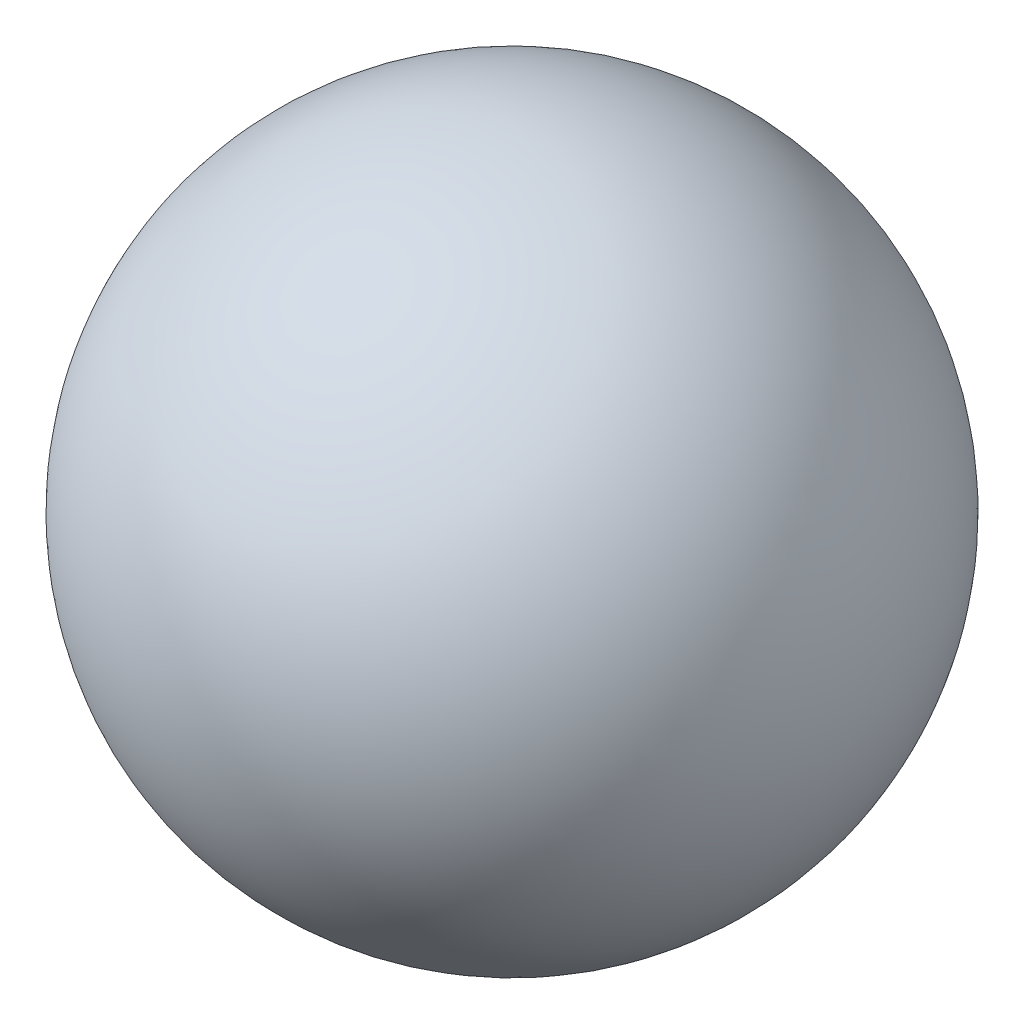
from build123d import *


with BuildPart() as part:
    # Sketch1 → Revolve1 (revolve)
    with BuildSketch(Plane(origin=(0, 0, 0), x_dir=(1, 0, 0), z_dir=(0, 1, 0))):
        with BuildLine():
            Line((-4.5, 0), (4.5, 0))
            ThreePointArc((4.5, 0), (0, 4.5), (-4.5, 0))
        make_face()
    revolve(axis=Axis((-4.5, 0, 0), (1, 0, 0)))


solid = part.part
